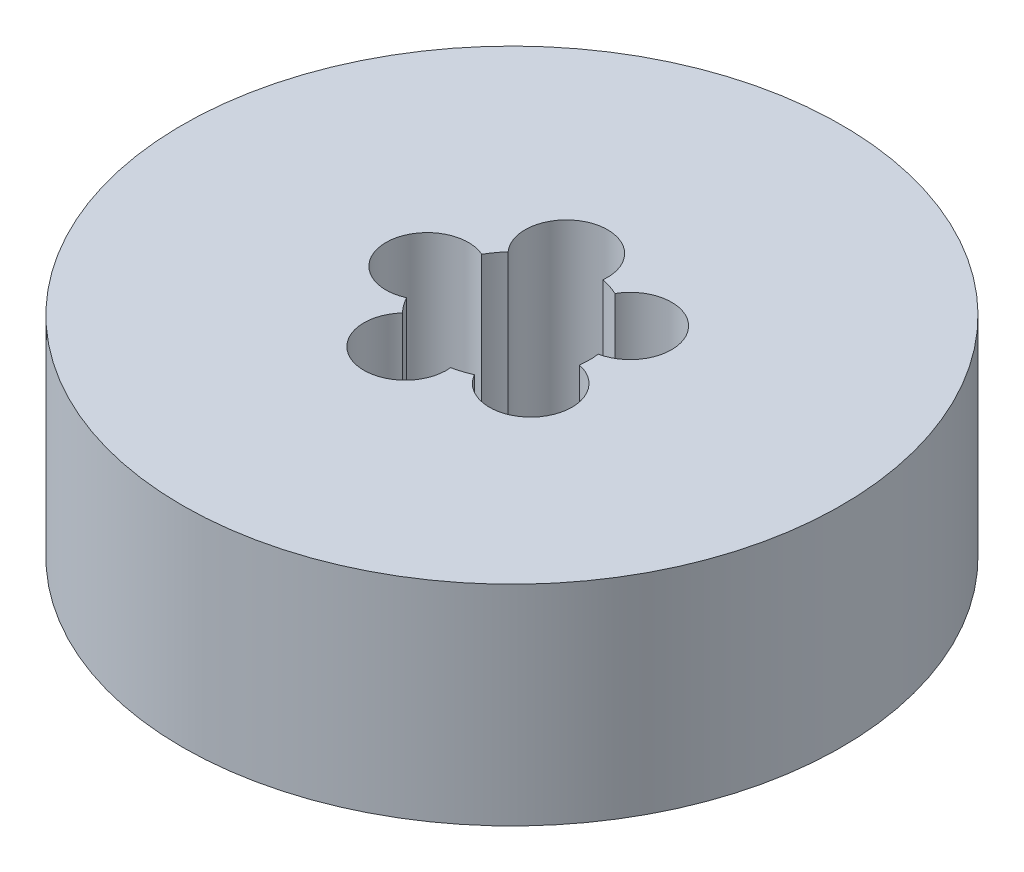
from build123d import *

# Parameters (mm, degrees)
SKETCH1_R           = 42.5
BOSS_EXTRUDE1_DEPTH = 27
SKETCH2_R           = 10
CUT_EXTRUDE1_DEPTH  = 66.890059948
SKETCH3_R           = 5.319531985
CUT_EXTRUDE2_DEPTH  = 24.157273814
CIRPATTERN1_COUNT   = 5


with BuildPart() as part:
    # Sketch1 → Boss-Extrude1 (new body)
    with BuildSketch(Plane(origin=(0, 0, 0), x_dir=(1, 0, 0), z_dir=(0, 1, 0))):
        Circle(SKETCH1_R)
    extrude(amount=BOSS_EXTRUDE1_DEPTH)

    # Sketch2 → Cut-Extrude1 (cut, through all)
    with BuildSketch(Plane(origin=(0, 0, 0), x_dir=(1, 0, 0), z_dir=(0, 1, 0))):
        Circle(SKETCH2_R)
    extrude(amount=CUT_EXTRUDE1_DEPTH, mode=Mode.SUBTRACT)

    # Sketch3 → Cut-Extrude2 (cut)
    with BuildSketch(Plane(origin=(0, 27, 0), x_dir=(1, 0, 0), z_dir=(0, 1, 0))):
        with Locations((-10.925774672, 0)):
            Circle(SKETCH3_R)
    cut_extrude2 = extrude(amount=-CUT_EXTRUDE2_DEPTH, mode=Mode.SUBTRACT)

    # CirPattern1: Cut-Extrude2 ×5 about axis
    cirpattern1_axis = Axis((0, 0, 0), (0, 1, 0))
    for i in range(1, CIRPATTERN1_COUNT):
        add(cut_extrude2.rotate(cirpattern1_axis, i * 360 / CIRPATTERN1_COUNT), mode=Mode.SUBTRACT)


solid = part.part
